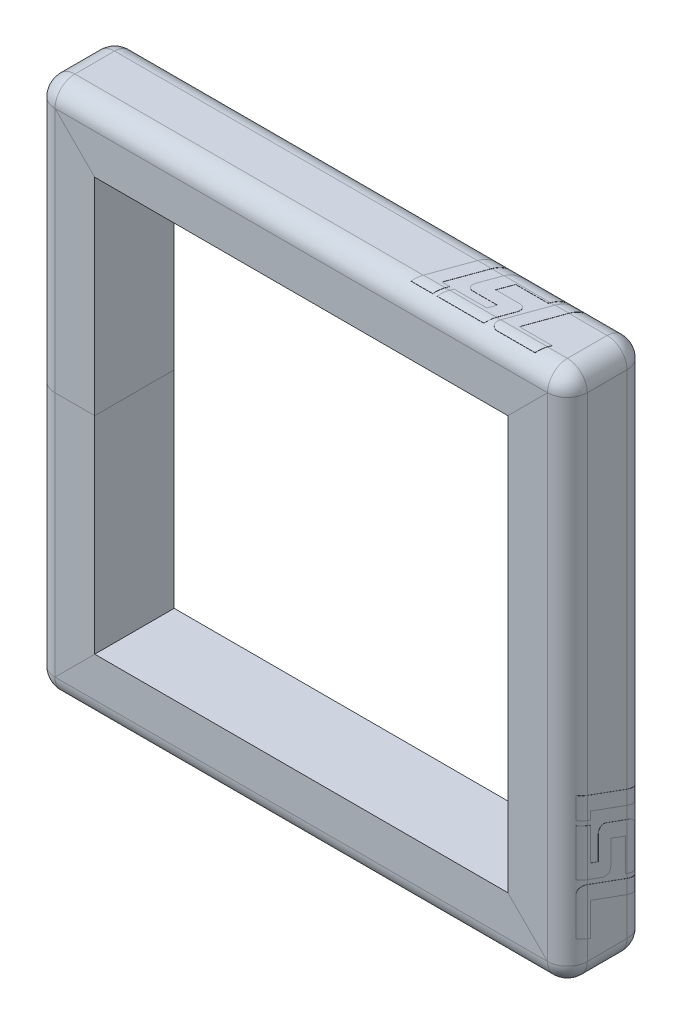
from build123d import *

# Parameters (mm, degrees)
FILLET1_R           = 31.75
BOSS_EXTRUDE1_START = -425.704
BOSS_EXTRUDE1_DEPTH = 5.260000457
CUT_EXTRUDE1_DEPTH  = 960.887340122
CIRPATTERN1_COUNT   = 4


# Read off the part's stored shape, not the designer's step: Boss-Extrude1
with BuildPart() as part:
    # Sweep1: sweep along a path in Sketch3
    with BuildLine(Plane.XY) as sweep1_path:
        Line((0, 330.2), (660.4, 330.2))
        Line((660.4, 330.2), (660.4, -330.2))
        Line((660.4, -330.2), (0, -330.2))
        Line((0, -330.2), (0, 330.2))
    # Sketch1 → Sweep1 (sweep)
    with BuildSketch(Plane(origin=(0, 0, 0), x_dir=(1, 0, 0), z_dir=(0, 1, 0))):
        with BuildLine():
            Line((0, 0), (-63.5, 0))
            ThreePointArc((-63.5, 0), (-85.950640303, 9.299359697), (-95.25, 31.75))
            Line((-95.25, 31.75), (-95.25, 95.25))
            ThreePointArc((-95.25, 95.25), (-85.950640303, 117.700640303), (-63.5, 127))
            Line((-63.5, 127), (0, 127))
            Line((0, 127), (0, 0))
        make_face()
    sweep(path=sweep1_path.line, transition=Transition.RIGHT)

    # Fillet1
    # the kernel refuses this fillet: 31.75 mm, written as the material it takes off along each edge
    with BuildSketch(Plane(origin=(723.9, -393.7, -95.25), x_dir=(0, -1, 0), z_dir=(1, 0, 0))) as fillet1_piece_1_section:
        Polygon((0, 0), (FILLET1_R * 1.02, 0), (FILLET1_R * 1.02, FILLET1_R * 1.02), (0, FILLET1_R * 1.02), align=None)
    fillet1_piece_1 = extrude(amount=FILLET1_R * 1.02, mode=Mode.PRIVATE)
    fillet1_piece_1 = fillet1_piece_1 - Plane(origin=(723.9, -393.7, -95.25), x_dir=(0, 0.7071067811865475, 0.7071067811865477), z_dir=(1, 0, 0)) * Sphere(FILLET1_R, mode=Mode.PRIVATE)
    add(fillet1_piece_1, mode=Mode.SUBTRACT)
    with BuildSketch(Plane(origin=(723.9, -393.7, -31.75), x_dir=(0, -1, 0), z_dir=(1, 0, 0))) as fillet1_piece_2_section:
        Polygon((0, 0), (FILLET1_R * 1.02, 0), (FILLET1_R * 1.02, -FILLET1_R * 1.02), (0, -FILLET1_R * 1.02), align=None)
    fillet1_piece_2 = extrude(amount=FILLET1_R * 1.02, mode=Mode.PRIVATE)
    fillet1_piece_2 = fillet1_piece_2 - Plane(origin=(723.9, -393.7, -31.75), x_dir=(0, 0.7071067811865477, -0.7071067811865474), z_dir=(1, 0, 0)) * Sphere(FILLET1_R, mode=Mode.PRIVATE)
    add(fillet1_piece_2, mode=Mode.SUBTRACT)
    with BuildSketch(Plane(origin=(-63.5, -393.7, -31.75), x_dir=(-1, 0, 0), z_dir=(0, -1, 0))) as fillet1_piece_3_section:
        Polygon((0, 0), (FILLET1_R * 1.02, 0), (FILLET1_R * 1.02, -FILLET1_R * 1.02), (0, -FILLET1_R * 1.02), align=None)
    fillet1_piece_3 = extrude(amount=FILLET1_R * 1.02, mode=Mode.PRIVATE)
    fillet1_piece_3 = fillet1_piece_3 - Plane(origin=(-63.5, -393.7, -31.75), x_dir=(0.7071067811865475, 0, -0.7071067811865475), z_dir=(0, -1, 0)) * Sphere(FILLET1_R, mode=Mode.PRIVATE)
    add(fillet1_piece_3, mode=Mode.SUBTRACT)
    with BuildSketch(Plane(origin=(-63.5, -393.7, -95.25), x_dir=(-1, 0, 0), z_dir=(0, -1, 0))) as fillet1_piece_4_section:
        Polygon((0, 0), (FILLET1_R * 1.02, 0), (FILLET1_R * 1.02, FILLET1_R * 1.02), (0, FILLET1_R * 1.02), align=None)
    fillet1_piece_4 = extrude(amount=FILLET1_R * 1.02, mode=Mode.PRIVATE)
    fillet1_piece_4 = fillet1_piece_4 - Plane(origin=(-63.5, -393.7, -95.25), x_dir=(0.7071067811865475, 0, 0.7071067811865475), z_dir=(0, -1, 0)) * Sphere(FILLET1_R, mode=Mode.PRIVATE)
    add(fillet1_piece_4, mode=Mode.SUBTRACT)
    with BuildSketch(Plane(origin=(723.9, 393.7, -31.75), x_dir=(1, 0, 0), z_dir=(0, 1, 0))) as fillet1_piece_5_section:
        Polygon((0, 0), (FILLET1_R * 1.02, 0), (FILLET1_R * 1.02, -FILLET1_R * 1.02), (0, -FILLET1_R * 1.02), align=None)
    fillet1_piece_5 = extrude(amount=FILLET1_R * 1.02, mode=Mode.PRIVATE)
    fillet1_piece_5 = fillet1_piece_5 - Plane(origin=(723.9, 393.7, -31.75), x_dir=(-0.7071067811865476, 0, -0.7071067811865475), z_dir=(0, 1, 0)) * Sphere(FILLET1_R, mode=Mode.PRIVATE)
    add(fillet1_piece_5, mode=Mode.SUBTRACT)
    with BuildSketch(Plane(origin=(723.9, 393.7, -95.25), x_dir=(1, 0, 0), z_dir=(0, 1, 0))) as fillet1_piece_6_section:
        Polygon((0, 0), (FILLET1_R * 1.02, 0), (FILLET1_R * 1.02, FILLET1_R * 1.02), (0, FILLET1_R * 1.02), align=None)
    fillet1_piece_6 = extrude(amount=FILLET1_R * 1.02, mode=Mode.PRIVATE)
    fillet1_piece_6 = fillet1_piece_6 - Plane(origin=(723.9, 393.7, -95.25), x_dir=(-0.7071067811865475, 0, 0.7071067811865477), z_dir=(0, 1, 0)) * Sphere(FILLET1_R, mode=Mode.PRIVATE)
    add(fillet1_piece_6, mode=Mode.SUBTRACT)
    with BuildSketch(Plane(origin=(-63.5, 393.7, -31.75), x_dir=(-1, 0, 0), z_dir=(0, 1, 0))) as fillet1_piece_7_section:
        Polygon((0, 0), (FILLET1_R * 1.02, 0), (FILLET1_R * 1.02, FILLET1_R * 1.02), (0, FILLET1_R * 1.02), align=None)
    fillet1_piece_7 = extrude(amount=FILLET1_R * 1.02, mode=Mode.PRIVATE)
    fillet1_piece_7 = fillet1_piece_7 - Plane(origin=(-63.5, 393.7, -31.75), x_dir=(0.7071067811865475, 0, -0.7071067811865475), z_dir=(0, 1, 0)) * Sphere(FILLET1_R, mode=Mode.PRIVATE)
    add(fillet1_piece_7, mode=Mode.SUBTRACT)
    with BuildSketch(Plane(origin=(-63.5, 393.7, -95.25), x_dir=(-1, 0, 0), z_dir=(0, 1, 0))) as fillet1_piece_8_section:
        Polygon((0, 0), (FILLET1_R * 1.02, 0), (FILLET1_R * 1.02, -FILLET1_R * 1.02), (0, -FILLET1_R * 1.02), align=None)
    fillet1_piece_8 = extrude(amount=FILLET1_R * 1.02, mode=Mode.PRIVATE)
    fillet1_piece_8 = fillet1_piece_8 - Plane(origin=(-63.5, 393.7, -95.25), x_dir=(0.7071067811865475, 0, 0.7071067811865475), z_dir=(0, 1, 0)) * Sphere(FILLET1_R, mode=Mode.PRIVATE)
    add(fillet1_piece_8, mode=Mode.SUBTRACT)
    with BuildSketch(Plane(origin=(755.65, -425.45, -31.75), x_dir=(0, 1, 0), z_dir=(0, 0, -1)), Plane(origin=(-95.25, -425.45, -31.75), x_dir=(1, 0, 0), z_dir=(0, 0, -1)), Plane(origin=(755.65, 425.45, -31.75), x_dir=(-1, 0, 0), z_dir=(0, 0, -1))) as fillet1_piece_9:
        with BuildLine():
            CenterArc((FILLET1_R, -FILLET1_R), FILLET1_R, 90, 90)
            Line((0, -FILLET1_R), (0, 0))
            Line((0, 0), (FILLET1_R, 0))
        make_face()
    extrude(amount=63.5, mode=Mode.SUBTRACT)
    with BuildSketch(Plane(origin=(-95.25, 425.45, -31.75), x_dir=(1, 0, 0), z_dir=(0, 0, -1))) as fillet1_piece_10:
        with BuildLine():
            CenterArc((FILLET1_R, FILLET1_R), FILLET1_R, 180, 90)
            Line((0, FILLET1_R), (0, 0))
            Line((0, 0), (FILLET1_R, 0))
        make_face()
    extrude(amount=63.5, mode=Mode.SUBTRACT)

    # Boss-Extrude1 outline → Boss-Extrude1 (add)
    with BuildSketch(Plane(origin=(0, 0, 0), x_dir=(1, 0, 0), z_dir=(0, 1, 0)).offset(BOSS_EXTRUDE1_START)):
        with BuildLine():
            add(Edge.make_bspline(
                [(34.320667614, 17.112012987), (35.019492779, 17.137980691), (36.370957131, 17.188199869), (38.282479723, 17.677292822), (39.982893876, 18.48683184), (41.428262625, 19.615966974), (42.631369551, 20.988759746), (43.467481307, 22.616607802), (43.988013735, 24.431637336), (44.049615579, 25.709454105), (44.081473214, 26.370282062)],
                knots=[0, 0, 0, 0, 0.138342138, 0.26754112, 0.388095737, 0.509210809, 0.628786838, 0.747066185, 0.869194285, 1, 1, 1, 1], degree=3))
            add(Edge.make_bspline(
                [(44.081473214, 26.370282062), (44.037119681, 27.156165566), (43.943813701, 28.809419006), (43.412917037, 30.37892941), (43.134385146, 31.202364042)],
                knots=[0, 0, 0, 0, 0.475355735, 1, 1, 1, 1], degree=3))
            Line((43.134385146, 31.202364042), (13.755326705, 112.362012987))
            Line((13.755326705, 112.362012987), (-8.607548701, 112.362012987))
            Line((-8.607548701, 112.362012987), (18.645393669, 36.904220779))
            Line((18.645393669, 36.904220779), (-33.811688312, 36.904220779))
            Line((-33.811688312, 36.904220779), (-26.466923701, 17.112012987))
            Line((-26.466923701, 17.112012987), (34.320667614, 17.112012987))
        make_face()
        with BuildLine():
            add(Edge.make_bspline(
                [(50.07325487, 69.066558442), (49.367681127, 69.04204999), (48.015431922, 68.995078949), (46.101200429, 68.493359086), (44.40590331, 67.699494503), (42.957808734, 66.587828518), (41.807056529, 65.203487426), (40.987445242, 63.597941366), (40.456671138, 61.800060341), (40.412637173, 60.52739406), (40.389762581, 59.866274351)],
                knots=[0, 0, 0, 0, 0.140361531, 0.269006281, 0.391362538, 0.511322892, 0.629879505, 0.74705779, 0.868602569, 1, 1, 1, 1], degree=3))
            add(Edge.make_bspline(
                [(40.389762581, 59.866274351), (40.445719803, 59.079434556), (40.563283483, 57.426318496), (41.134276789, 55.869391412), (41.433492289, 55.053520698)],
                knots=[0, 0, 0, 0, 0.475973717, 1, 1, 1, 1], degree=3))
            Line((41.433492289, 55.053520698), (55.233918425, 17.112012987))
            Line((55.233918425, 17.112012987), (130.034547484, 17.112012987))
            Line((130.034547484, 17.112012987), (122.786424513, 36.904220779))
            Line((122.786424513, 36.904220779), (70.387327516, 36.904220779))
            Line((70.387327516, 36.904220779), (65.88382711, 49.274350649))
            Line((65.88382711, 49.274350649), (104.443841315, 49.274350649))
            add(Edge.make_bspline(
                [(104.443841315, 49.274350649), (105.148861151, 49.301150689), (106.498469103, 49.352453567), (108.41854345, 49.822983829), (110.10384096, 50.618750247), (111.540215733, 51.72473572), (112.705236702, 53.068125146), (113.533387027, 54.650347929), (114.058085667, 56.418486872), (114.103730266, 57.671869685), (114.127333604, 58.320008117)],
                knots=[0, 0, 0, 0, 0.141541635, 0.270950839, 0.39433582, 0.513488719, 0.632887693, 0.748757904, 0.87007987, 1, 1, 1, 1], degree=3))
            add(Edge.make_bspline(
                [(114.127333604, 58.320008117), (114.080272202, 59.085952931), (113.981323696, 60.696382967), (113.481173442, 62.231255909), (113.218902192, 63.03612013)],
                knots=[0, 0, 0, 0, 0.475615082, 1, 1, 1, 1], degree=3))
            Line((113.218902192, 63.03612013), (100.500862419, 97.769125406))
            add(Edge.make_bspline(
                [(100.500862419, 97.769125406), (100.11826507, 98.743291714), (99.352031524, 100.694269439), (97.64152774, 103.403173185), (95.473006024, 105.878136853), (92.934732096, 108.100416672), (90.181784048, 109.978881932), (87.292467348, 111.3366584), (84.366382612, 112.201541661), (82.382913235, 112.309002778), (81.404474432, 112.362012987)],
                knots=[0, 0, 0, 0, 0.123133118, 0.246600573, 0.375247835, 0.509751588, 0.64327011, 0.766574017, 0.884851744, 1, 1, 1, 1], degree=3))
            Line((81.404474432, 112.362012987), (20.616883117, 112.362012987))
            Line((20.616883117, 112.362012987), (27.826349432, 92.569805195))
            Line((27.826349432, 92.569805195), (80.032163149, 92.569805195))
            Line((80.032163149, 92.569805195), (88.633269075, 69.066558442))
            Line((88.633269075, 69.066558442), (50.07325487, 69.066558442))
        make_face()
        Polygon((129.763950893, 36.904220779), (137.108715503, 17.112012987), (171.841720779, 17.112012987), (137.224685471, 112.362012987), (114.861810065, 112.362012987), (142.269379058, 36.904220779), align=None)
    boss_extrude1 = extrude(amount=BOSS_EXTRUDE1_DEPTH)

    # Sketch7 → Cut-Extrude1 (cut, through all)
    with BuildSketch(Plane(origin=(755.65, 0, 0), x_dir=(0, 0, -1), z_dir=(1, 0, 0))):
        with BuildLine():
            Line((-0.254, -393.7), (-14.919350322, -408.044857645))
            Line((-14.919350322, -408.044857645), (26.026763361, -449.905789022))
            Line((26.026763361, -449.905789022), (133.874298809, -452.770559539))
            Line((133.874298809, -452.770559539), (148.435040414, -412.199652452))
            Line((148.435040414, -412.199652452), (127.254, -393.7))
            ThreePointArc((127.254, -393.7), (117.880245425, -416.330245425), (95.25, -425.704))
            Line((95.25, -425.704), (31.75, -425.704))
            ThreePointArc((31.75, -425.704), (9.119754575, -416.330245425), (-0.254, -393.7))
        make_face()
    cut_extrude1 = extrude(amount=-CUT_EXTRUDE1_DEPTH, mode=Mode.SUBTRACT)

    # CirPattern1: Boss-Extrude1, Cut-Extrude1 ×4 about axis
    cirpattern1_axis = Axis((330.2, 0, -63.5), (0, 0, -1))
    add([boss_extrude1.rotate(cirpattern1_axis, i * 360 / CIRPATTERN1_COUNT) for i in range(1, CIRPATTERN1_COUNT)])
    add([cut_extrude1.rotate(cirpattern1_axis, i * 360 / CIRPATTERN1_COUNT) for i in range(1, CIRPATTERN1_COUNT)], mode=Mode.SUBTRACT)


solid = part.part
